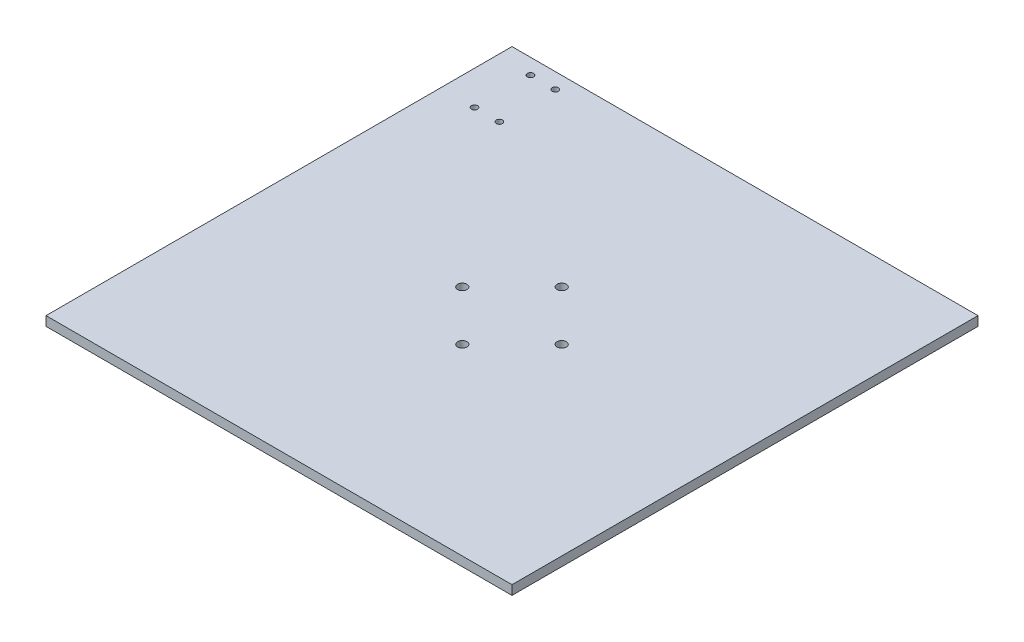
from build123d import *

# Parameters (mm, degrees)
SKETCH1_W           = 150
SKETCH1_H           = 150
BOSS_EXTRUDE1_DEPTH = 3
SKETCH2_R           = 1.5
SKETCH2_R_2         = 1
CUT_EXTRUDE1_DEPTH  = 10


with BuildPart() as part:
    # Sketch1 → Boss-Extrude1 (new body)
    with BuildSketch(Plane(origin=(0, 0, 0), x_dir=(1, 0, 0), z_dir=(0, 1, 0))):
        with Locations((75, 75)):
            Rectangle(SKETCH1_W, SKETCH1_H)
    extrude(amount=BOSS_EXTRUDE1_DEPTH)

    # Sketch2 → Cut-Extrude1 (cut)
    with BuildSketch(Plane(origin=(0, 3, 0), x_dir=(1, 0, 0), z_dir=(0, 1, 0))):
        with Locations((75, 59)):
            Circle(SKETCH2_R)
        with Locations((59, 75)):
            Circle(SKETCH2_R)
        with Locations((75, 91)):
            Circle(SKETCH2_R)
        with Locations((91, 75)):
            Circle(SKETCH2_R)
        with Locations((18.93, 145)):
            Circle(SKETCH2_R_2)
        with Locations((10.93, 145)):
            Circle(SKETCH2_R_2)
        with Locations((18.93, 127)):
            Circle(SKETCH2_R_2)
        with Locations((10.93, 127)):
            Circle(SKETCH2_R_2)
    extrude(amount=-CUT_EXTRUDE1_DEPTH, mode=Mode.SUBTRACT)


solid = part.part
